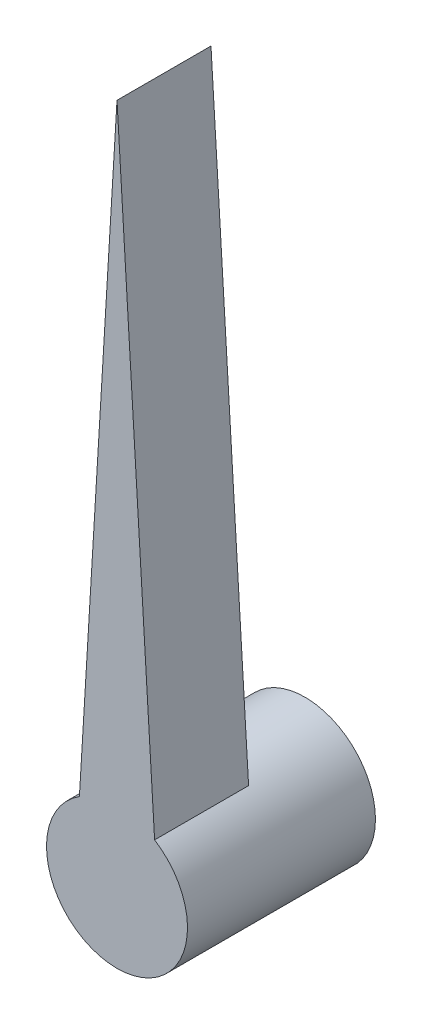
from build123d import *

# Parameters (mm, degrees)
SKETCH1_R           = 3.81
BOSS_EXTRUDE2_DEPTH = 10.16
SKETCH3_R           = 2.54
CUT_EXTRUDE1_DEPTH  = 5.08
BOSS_EXTRUDE3_DEPTH = 5.08


with BuildPart() as part:
    # Sketch1 → Boss-Extrude2 (new body)
    with BuildSketch(Plane.XY):
        Circle(SKETCH1_R)
    extrude(amount=BOSS_EXTRUDE2_DEPTH)

    # Sketch3 → Cut-Extrude1 (cut)
    with BuildSketch(Plane(origin=(0, 0, 0), x_dir=(-1, 0, 0), z_dir=(0, 0, -1))):
        Circle(SKETCH3_R)
    extrude(amount=-CUT_EXTRUDE1_DEPTH, mode=Mode.SUBTRACT)

    # Sketch4 → Boss-Extrude3 (add)
    with BuildSketch(Plane.XY.offset(10.16)):
        Polygon((-2.032318753, 3.222697703), (2.032318753, 3.222697703), (0, 36.83), align=None)
    extrude(amount=-BOSS_EXTRUDE3_DEPTH)


solid = part.part
